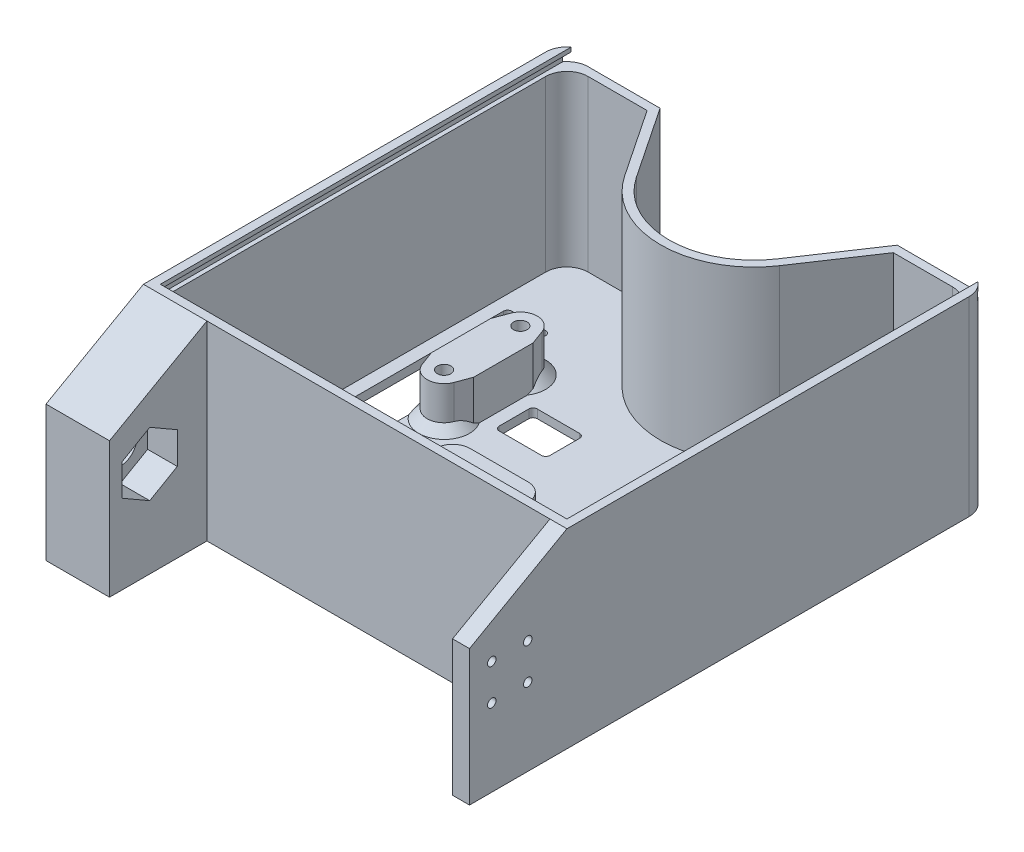
from build123d import *

# Parameters (mm, degrees)
AUFSATZ_LINEAR_AUSTRAGEN1_DEPTH  = 45
WANDUNG1_T                       = -2
SKIZZE1_W                        = 10
SKIZZE1_H                        = 42
SCHNITT_LINEAR_AUSTRAGEN1_DEPTH  = 2
SKIZZE2_R                        = 1.6
AUFSATZ_LINEAR_AUSTRAGEN2_DEPTH  = 10
VERRUNDUNG1_R                    = 1
SKIZZE6_R                        = 1.6
SCHNITT_LINEAR_AUSTRAGEN2_DEPTH  = 79.0320447
SCHNITT_LINEAR_AUSTRAGEN3_DEPTH  = 9
FASE1_SIZE                       = 2
SKIZZE8_W                        = 12
SKIZZE8_H                        = 9
SCHNITT_LINEAR_AUSTRAGEN4_DEPTH  = 2
VERRUNDUNG2_R                    = 1
VERRUNDUNG3_R                    = 5
VERRUNDUNG4_R                    = 5
SCHNITT_LINEAR_AUSTRAGEN5_REACH  = 85.815
AUFSATZ_LINEAR_AUSTRAGEN3_DEPTH  = 12
AUFSATZ_LINEAR_AUSTRAGEN4_DEPTH  = 2
FASE2_SIZE                       = 2
SKIZZE13_R                       = 1.6
SCHNITT_LINEAR_AUSTRAGEN6_DEPTH  = 2
SKIZZE14_W                       = 15
SKIZZE14_H                       = 45
SKIZZE14_W_2                     = 4
AUFSATZ_LINEAR_AUSTRAGEN5_DEPTH  = 23
SKIZZE18_R                       = 1
SCHNITT_LINEAR_AUSTRAGEN8_DEPTH  = 4
SKIZZE19_R                       = 2.5
SCHNITT_LINEAR_AUSTRAGEN9_DEPTH  = 2.5
SKIZZE20_W                       = 5
SKIZZE20_H                       = 10
SCHNITT_LINEAR_AUSTRAGEN10_DEPTH = 2
SKIZZE21_R                       = 4
SCHNITT_LINEAR_AUSTRAGEN11_DEPTH = 15
SKIZZE23_R                       = 7.5
SCHNITT_LINEAR_AUSTRAGEN12_DEPTH = 1
SKIZZE24_R                       = 7.5
SCHNITT_LINEAR_AUSTRAGEN13_DEPTH = 4
SCHNITT_LINEAR_AUSTRAGEN13_DRAFT = -45
SCHNITT_LINEAR_AUSTRAGEN14_DEPTH = 7
SCHNITT_LINEAR_AUSTRAGEN15_REACH = 133.735
SKIZZE31_W                       = 96
SKIZZE31_H                       = 3
SCHNITT_LINEAR_AUSTRAGEN16_DEPTH = 30
SKIZZE32_W                       = 98
SKIZZE32_H                       = 2
SCHNITT_LINEAR_AUSTRAGEN17_DEPTH = 99


# Some blends are built 0.0001 mm under size
with BuildPart() as part:
    # Grundplatte → Aufsatz-Linear austragen1 (new body)
    with BuildSketch(Plane(origin=(0, 0, 0), x_dir=(1, 0, 0), z_dir=(0, 1, 0))):
        with BuildLine():
            Line((-50, 50), (-50, -50))
            Line((-50, -50), (50, -50))
            Line((50, -50), (50, 50))
            Line((50, 50), (28, 50))
            Line((28, 50), (16.61985221, 33))
            ThreePointArc((16.61985221, 33), (0, 24.125669082), (-16.61985221, 33))
            Line((-16.61985221, 33), (-28, 50))
            Line((-28, 50), (-50, 50))
        make_face()
    extrude(amount=AUFSATZ_LINEAR_AUSTRAGEN1_DEPTH)

    # Wandung1
    wandung1_openings = [part.faces().sort_by_distance(p)[0] for p in [
        (0, 45, 4.219695438),
    ]]
    offset(amount=WANDUNG1_T, openings=wandung1_openings, kind=Kind.INTERSECTION)

    # Skizze1 → Schnitt-Linear austragen1 (cut)
    with BuildSketch(Plane(origin=(0, 2, 0), x_dir=(1, 0, 0), z_dir=(0, 1, 0))):
        with Locations((-40, 10)):
            Rectangle(SKIZZE1_W, SKIZZE1_H)
        with Locations((40, 10)):
            Rectangle(SKIZZE1_W, SKIZZE1_H)
    extrude(amount=-SCHNITT_LINEAR_AUSTRAGEN1_DEPTH, mode=Mode.SUBTRACT)

    # Skizze2 → Aufsatz-Linear austragen2 (add)
    # profile 1 of 2: a face of its own
    with BuildSketch(Plane(origin=(0, 2, 0), x_dir=(1, 0, 0), z_dir=(0, 1, 0))):
        with BuildLine():
            Line((-35, 16), (-35, 4))
            Line((-35, 4), (-35, 3))
            Line((-35, 3), (-33.753255524, -0.383138811))
            ThreePointArc((-33.753255524, -0.383138811), (-30, -3), (-26.246744476, -0.383138811))
            Line((-26.246744476, -0.383138811), (-25, 3))
            Line((-25, 3), (-25, 4))
            Line((-25, 4), (-25, 16))
            Line((-25, 16), (-25, 17))
            Line((-25, 17), (-26.246744476, 20.383138811))
            ThreePointArc((-26.246744476, 20.383138811), (-30, 23), (-33.753255524, 20.383138811))
            Line((-33.753255524, 20.383138811), (-35, 17))
            Line((-35, 17), (-35, 16))
        make_face()
        with Locations(Location((-30, 19, 0), (0, 0, 270))):
            Circle(SKIZZE2_R, mode=Mode.SUBTRACT)
        with Locations(Location((-30, 1, 0), (0, 0, 270))):
            Circle(SKIZZE2_R, mode=Mode.SUBTRACT)
    # profile 2 of 2: a face of its own
    with BuildSketch(Plane(origin=(0, 2, 0), x_dir=(1, 0, 0), z_dir=(0, 1, 0))):
        with BuildLine():
            Line((35, 16), (35, 17))
            Line((35, 17), (33.753255524, 20.383138811))
            ThreePointArc((33.753255524, 20.383138811), (30, 23), (26.246744476, 20.383138811))
            Line((26.246744476, 20.383138811), (25, 17))
            Line((25, 17), (25, 16))
            Line((25, 16), (25, 4))
            Line((25, 4), (25, 3))
            Line((25, 3), (26.246744476, -0.383138811))
            ThreePointArc((26.246744476, -0.383138811), (30, -3), (33.753255524, -0.383138811))
            Line((33.753255524, -0.383138811), (35, 3))
            Line((35, 3), (35, 4))
            Line((35, 4), (35, 16))
        make_face()
        with Locations(Location((30, 1, 0), (0, 0, 90))):
            Circle(SKIZZE2_R, mode=Mode.SUBTRACT)
        with Locations(Location((30, 19, 0), (0, 0, 90))):
            Circle(SKIZZE2_R, mode=Mode.SUBTRACT)
    extrude(amount=AUFSATZ_LINEAR_AUSTRAGEN2_DEPTH)

    # Verrundung1
    verrundung1_edges = [part.edges().sort_by_distance(p)[0] for p in [
        (-35, 1, -31),
        (-35, 1, 11),
        (-45, 1, 11),
        (-45, 1, -31),
        (45, 1, -31),
        (45, 1, 11),
        (35, 1, 11),
        (35, 1, -31),
    ]]
    fillet(verrundung1_edges, radius=VERRUNDUNG1_R)

    # Skizze6 → Schnitt-Linear austragen2 (cut, through all)
    with BuildSketch(Plane(origin=(0, 12, 0), x_dir=(1, 0, 0), z_dir=(0, 1, 0))):
        with Locations(Location((-30, 19, 0), (0, 0, 270))):
            Circle(SKIZZE6_R)
        with Locations(Location((-30, 1, 0), (0, 0, 270))):
            Circle(SKIZZE6_R)
        with Locations(Location((30, 19, 0), (0, 0, 90))):
            Circle(SKIZZE6_R)
        with Locations(Location((30, 1, 0), (0, 0, 90))):
            Circle(SKIZZE6_R)
    extrude(amount=-SCHNITT_LINEAR_AUSTRAGEN2_DEPTH, mode=Mode.SUBTRACT)

    # Skizze7 → Schnitt-Linear austragen3 (cut)
    with BuildSketch(Plane.XZ):
        Polygon((-26.709103466, -1), (-28.354551733, 1.85), (-31.645448267, 1.85), (-33.290896534, -1), (-31.645448267, -3.85), (-28.354551733, -3.85), align=None)
        Polygon((28.354551733, -21.85), (26.709103466, -19), (28.354551733, -16.15), (31.645448267, -16.15), (33.290896534, -19), (31.645448267, -21.85), align=None)
        Polygon((-26.709103466, -19), (-28.354551733, -16.15), (-31.645448267, -16.15), (-33.290896534, -19), (-31.645448267, -21.85), (-28.354551733, -21.85), align=None)
        Polygon((28.354551733, -3.85), (26.709103466, -1), (28.354551733, 1.85), (31.645448267, 1.85), (33.290896534, -1), (31.645448267, -3.85), align=None)
    extrude(amount=-SCHNITT_LINEAR_AUSTRAGEN3_DEPTH, mode=Mode.SUBTRACT)

    # Fase1
    # the kernel refuses this chamfer: 2 mm, written as the material it adds along each edge
    with BuildSketch(Plane(origin=(33.753255524, 2, 0.383138811), x_dir=(0.9379591204561566, -0.02749587661058633, 0.3456539673177909), z_dir=(0.3457847026662013, 0, -0.9383138810664834))) as fase1_piece_1_section:
        Polygon((FASE1_SIZE * 0.999621916911, -FASE1_SIZE * 0.0274958766106), (-FASE1_SIZE * 0.0274958766106, -FASE1_SIZE * 0.999621916911), (0, 0), align=None)
    fase1_piece_1 = extrude(amount=8.748917251, mode=Mode.PRIVATE)
    fase1_piece_1 = split(fase1_piece_1, bisect_by=Plane(origin=(35, 2.810043693, -0.69339811), z_dir=(-1, 0, 0)), keep=Keep.TOP, mode=Mode.PRIVATE)
    add(fase1_piece_1)
    with BuildSketch(Plane(origin=(30, 2, -1), x_dir=(-0.5946157089023157, 0, -0.8040100488965276), z_dir=(0.8040100488965276, 0, -0.5946157089023157))) as fase1_piece_2_section:
        Polygon((4 + FASE1_SIZE, 0), (4, FASE1_SIZE), (4, 0), align=None)
    fase1_piece_2 = revolve(axis=Axis((30, 2, -1), (0, 1, 0)), revolution_arc=213.285054007, mode=Mode.PRIVATE)
    fase1_piece_2 = split(fase1_piece_2, bisect_by=Plane(origin=(35, 2.618842305, 0.921149391), z_dir=(-1, 0, 0)), keep=Keep.TOP, mode=Mode.PRIVATE)
    add(fase1_piece_2)
    with BuildSketch(Plane(origin=(36.778497275, 2, -12.173908309), x_dir=(0.937959120456157, -0.027495876610586348, -0.34565396731779), z_dir=(-0.34578470266620037, 0, -0.9383138810664838))) as fase1_piece_3_section:
        Polygon((FASE1_SIZE * 0.999621916911, -FASE1_SIZE * 0.0274958766106), (-FASE1_SIZE * 0.0274958766106, -FASE1_SIZE * 0.999621916911), (0, 0), align=None)
    fase1_piece_3 = extrude(amount=8.748917251, mode=Mode.PRIVATE)
    fase1_piece_3 = split(fase1_piece_3, bisect_by=Plane(origin=(35, 2.810043693, -19.30660189), z_dir=(-1, 0, 0)), keep=Keep.TOP, mode=Mode.PRIVATE)
    add(fase1_piece_3)
    with BuildSketch(Plane(origin=(30, 2, -19), x_dir=(0.9383138810664835, 0, -0.3457847026662016), z_dir=(0.3457847026662016, 0, 0.9383138810664835))) as fase1_piece_4_section:
        Polygon((4 + FASE1_SIZE, 0), (4, FASE1_SIZE), (4, 0), align=None)
    fase1_piece_4 = revolve(axis=Axis((30, 2, -19), (0, 1, 0)), revolution_arc=213.285054007, mode=Mode.PRIVATE)
    fase1_piece_4 = split(fase1_piece_4, bisect_by=Plane(origin=(35, 2.568302244, -21.912371656), z_dir=(-1, 0, 0)), keep=Keep.TOP, mode=Mode.PRIVATE)
    add(fase1_piece_4)
    with BuildSketch(Plane(origin=(-33.753255524, 2, -20.383138811), x_dir=(-0.9379591204561563, -0.02749587661058632, -0.34565396731779174), z_dir=(-0.34578470266620215, 0, 0.9383138810664832))) as fase1_piece_5_section:
        Polygon((FASE1_SIZE * 0.999621916911, -FASE1_SIZE * 0.0274958766106), (-FASE1_SIZE * 0.0274958766106, -FASE1_SIZE * 0.999621916911), (0, 0), align=None)
    fase1_piece_5 = extrude(amount=8.748917251, mode=Mode.PRIVATE)
    fase1_piece_5 = split(fase1_piece_5, bisect_by=Plane(origin=(-35, 2.810043693, -19.30660189), z_dir=(1, 0, 0)), keep=Keep.TOP, mode=Mode.PRIVATE)
    add(fase1_piece_5)
    with BuildSketch(Plane(origin=(-30, 2, -19), x_dir=(0.5946157089023089, 0, 0.8040100488965327), z_dir=(-0.8040100488965327, 0, 0.5946157089023089))) as fase1_piece_6_section:
        Polygon((4 + FASE1_SIZE, 0), (4, FASE1_SIZE), (4, 0), align=None)
    fase1_piece_6 = revolve(axis=Axis((-30, 2, -19), (0, 1, 0)), revolution_arc=213.285054007, mode=Mode.PRIVATE)
    fase1_piece_6 = split(fase1_piece_6, bisect_by=Plane(origin=(-35, 2.618842305, -20.921149391), z_dir=(1, 0, 0)), keep=Keep.TOP, mode=Mode.PRIVATE)
    add(fase1_piece_6)
    with BuildSketch(Plane(origin=(-36.778497275, 2, -7.826091691), x_dir=(-0.937959120456156, -0.02749587661058632, 0.3456539673177927), z_dir=(0.3457847026662031, 0, 0.9383138810664828))) as fase1_piece_7_section:
        Polygon((FASE1_SIZE * 0.999621916911, -FASE1_SIZE * 0.0274958766106), (-FASE1_SIZE * 0.0274958766106, -FASE1_SIZE * 0.999621916911), (0, 0), align=None)
    fase1_piece_7 = extrude(amount=8.748917251, mode=Mode.PRIVATE)
    fase1_piece_7 = split(fase1_piece_7, bisect_by=Plane(origin=(-35, 2.810043693, -0.69339811), z_dir=(1, 0, 0)), keep=Keep.TOP, mode=Mode.PRIVATE)
    add(fase1_piece_7)
    with BuildSketch(Plane(origin=(-30, 2, -1), x_dir=(-0.9383138810664808, 0, 0.34578470266620803), z_dir=(-0.34578470266620803, 0, -0.9383138810664808))) as fase1_piece_8_section:
        Polygon((4 + FASE1_SIZE, 0), (4, FASE1_SIZE), (4, 0), align=None)
    fase1_piece_8 = revolve(axis=Axis((-30, 2, -1), (0, 1, 0)), revolution_arc=213.285054007, mode=Mode.PRIVATE)
    fase1_piece_8 = split(fase1_piece_8, bisect_by=Plane(origin=(-35, 2.568302244, 1.912371656), z_dir=(1, 0, 0)), keep=Keep.TOP, mode=Mode.PRIVATE)
    add(fase1_piece_8)

    # Skizze8 → Schnitt-Linear austragen4 (cut)
    with BuildSketch(Plane.XZ):
        with Locations((16, -9.5)):
            Rectangle(SKIZZE8_W, SKIZZE8_H)
        with Locations((-16, -9.5)):
            Rectangle(SKIZZE8_W, SKIZZE8_H)
    extrude(amount=-SCHNITT_LINEAR_AUSTRAGEN4_DEPTH, mode=Mode.SUBTRACT)

    # Verrundung2
    verrundung2_edges = [part.edges().sort_by_distance(p)[0] for p in [
        (-10, 1, -14),
        (-10, 1, -5),
        (-22, 1, -5),
        (-22, 1, -14),
        (10, 1, -5),
        (10, 1, -14),
        (22, 1, -14),
        (22, 1, -5),
    ]]
    fillet(verrundung2_edges, radius=VERRUNDUNG2_R)

    # Verrundung3
    verrundung3_edges = [part.edges().sort_by_distance(p)[0] for p in [
        (-50, 22.5, -50),
        (50, 22.5, -50),
    ]]
    fillet(verrundung3_edges, radius=VERRUNDUNG3_R)

    # Verrundung4
    verrundung4_edges = [part.edges().sort_by_distance(p)[0] for p in [
        (48, 23.5, -48),
        (-48, 23.5, -48),
    ]]
    fillet(verrundung4_edges, radius=VERRUNDUNG4_R)

    # Skizze9 → Schnitt-Linear austragen5 (cut, up to next)
    with BuildSketch(Plane.XZ, mode=Mode.PRIVATE) as schnitt_linear_austragen5_sk1:
        with BuildLine():
            Line((-6.8, 43), (6.8, 43))
            ThreePointArc((6.8, 43), (7.648528137, 42.648528137), (8, 41.8))
            Line((8, 41.8), (8, 20.2))
            ThreePointArc((8, 20.2), (7.648528137, 19.351471863), (6.8, 19))
            Line((6.8, 19), (-6.8, 19))
            ThreePointArc((-6.8, 19), (-7.648528137, 19.351471863), (-8, 20.2))
            Line((-8, 20.2), (-8, 41.8))
            ThreePointArc((-8, 41.8), (-7.648528137, 42.648528137), (-6.8, 43))
        make_face()
    schnitt_linear_austragen5_tool1 = extrude(schnitt_linear_austragen5_sk1.sketch, amount=-SCHNITT_LINEAR_AUSTRAGEN5_REACH, mode=Mode.PRIVATE) & part.part
    add(schnitt_linear_austragen5_tool1.solids().sort_by_distance((0, 0, 31))[0], mode=Mode.SUBTRACT)

    # Skizze11 → Aufsatz-Linear austragen3 (add)
    with BuildSketch(Plane(origin=(0, 2, 0), x_dir=(1, 0, 0), z_dir=(0, 1, 0))):
        with BuildLine():
            Line((-6.8, -46), (6.8, -46))
            ThreePointArc((6.8, -46), (9.769848481, -44.769848481), (11, -41.8))
            Line((11, -41.8), (11, -20.2))
            ThreePointArc((11, -20.2), (9.769848481, -17.230151519), (6.8, -16))
            Line((6.8, -16), (-6.8, -16))
            ThreePointArc((-6.8, -16), (-9.769848481, -17.230151519), (-11, -20.2))
            Line((-11, -20.2), (-11, -41.8))
            ThreePointArc((-11, -41.8), (-9.769848481, -44.769848481), (-6.8, -46))
        make_face()
        with BuildLine():
            Line((-8, -20.2), (-8, -41.8))
            ThreePointArc((-8, -41.8), (-7.648528137, -42.648528137), (-6.8, -43))
            Line((-6.8, -43), (6.8, -43))
            ThreePointArc((6.8, -43), (7.648528137, -42.648528137), (8, -41.8))
            Line((8, -41.8), (8, -20.2))
            ThreePointArc((8, -20.2), (7.648528137, -19.351471863), (6.8, -19))
            Line((6.8, -19), (-6.8, -19))
            ThreePointArc((-6.8, -19), (-7.648528137, -19.351471863), (-8, -20.2))
        make_face(mode=Mode.SUBTRACT)
    extrude(amount=AUFSATZ_LINEAR_AUSTRAGEN3_DEPTH)

    # Skizze12 → Aufsatz-Linear austragen4 (add)
    with BuildSketch(Plane(origin=(0, 14, 0), x_dir=(1, 0, 0), z_dir=(0, 1, 0))):
        with BuildLine():
            Line((11, -41.8), (11, -20.2))
            ThreePointArc((11, -20.2), (9.769848481, -17.230151519), (6.8, -16))
            Line((6.8, -16), (-6.8, -16))
            ThreePointArc((-6.8, -16), (-9.769848481, -17.230151519), (-11, -20.2))
            Line((-11, -20.2), (-11, -41.8))
            ThreePointArc((-11, -41.8), (-9.769848481, -44.769848481), (-6.8, -46))
            Line((-6.8, -46), (6.8, -46))
            ThreePointArc((6.8, -46), (9.769848481, -44.769848481), (11, -41.8))
        make_face()
    extrude(amount=AUFSATZ_LINEAR_AUSTRAGEN4_DEPTH)

    # Fase2
    fase2_edges = [part.edges().sort_by_distance(p)[0] for p in [
        (9.769848481, 2, 44.769848481),
        (11, 2, 31),
        (9.769848481, 2, 17.230151519),
        (0, 2, 16),
        (-9.769848481, 2, 17.230151519),
        (-11, 2, 31),
        (-9.769848481, 2, 44.769848481),
        (0, 2, 46),
    ]]
    chamfer(fase2_edges, length=FASE2_SIZE - 0.0001)  # a hair under: the kernel refuses the full size

    # Skizze13 → Schnitt-Linear austragen6 (cut)
    with BuildSketch(Plane(origin=(0, 16, 0), x_dir=(1, 0, 0), z_dir=(0, 1, 0))):
        with Locations(Location((0, -23, 0), (0, 0, 270))):
            Circle(SKIZZE13_R)
        with Locations(Location((0, -39, 0), (0, 0, 270))):
            Circle(SKIZZE13_R)
    extrude(amount=-SCHNITT_LINEAR_AUSTRAGEN6_DEPTH, mode=Mode.SUBTRACT)

    # Skizze14 → Aufsatz-Linear austragen5 (add)
    with BuildSketch(Plane.XY.offset(50)):
        with Locations((-42.5, 22.5)):
            Rectangle(SKIZZE14_W, SKIZZE14_H)
        with Locations((48, 22.5)):
            Rectangle(SKIZZE14_W_2, SKIZZE14_H)
    extrude(amount=AUFSATZ_LINEAR_AUSTRAGEN5_DEPTH)

    # Skizze18 → Schnitt-Linear austragen8 (cut)
    with BuildSketch(Plane(origin=(50, 0, 0), x_dir=(0, 0, -1), z_dir=(1, 0, 0))):
        with Locations((-59.257359313, 18.257359313)):
            Circle(SKIZZE18_R)
        with Locations((-67.742640687, 18.257359313)):
            Circle(SKIZZE18_R)
        with Locations((-67.742640687, 26.742640687)):
            Circle(SKIZZE18_R)
        with Locations((-59.257359313, 26.742640687)):
            Circle(SKIZZE18_R)
    extrude(amount=-SCHNITT_LINEAR_AUSTRAGEN8_DEPTH, mode=Mode.SUBTRACT)

    # Skizze19 → Schnitt-Linear austragen9 (cut)
    with BuildSketch(Plane.ZY.offset(-46)):
        with Locations(Location((63.5, 22.5, 0), (0, 0, 270))):
            Circle(SKIZZE19_R)
    extrude(amount=-SCHNITT_LINEAR_AUSTRAGEN9_DEPTH, mode=Mode.SUBTRACT)

    # Skizze20 → Schnitt-Linear austragen10 (cut)
    with BuildSketch(Plane.XY.offset(50)):
        with Locations((43.5, 22.5)):
            Rectangle(SKIZZE20_W, SKIZZE20_H)
    extrude(amount=-SCHNITT_LINEAR_AUSTRAGEN10_DEPTH, mode=Mode.SUBTRACT)

    # Skizze21 → Schnitt-Linear austragen11 (cut)
    with BuildSketch(Plane.ZY.offset(50)):
        with Locations((63.5, 22.5)):
            Circle(SKIZZE21_R)
    extrude(amount=-SCHNITT_LINEAR_AUSTRAGEN11_DEPTH, mode=Mode.SUBTRACT)

    # Skizze23 → Schnitt-Linear austragen12 (cut)
    with BuildSketch(Plane.ZY.offset(50)):
        with Locations((63.5, 22.5)):
            Circle(SKIZZE23_R)
    extrude(amount=-SCHNITT_LINEAR_AUSTRAGEN12_DEPTH, mode=Mode.SUBTRACT)


with BuildPart() as schnitt_linear_austragen13_tool:
    # Skizze24 → Schnitt-Linear austragen13 (with draft: the straight prism first)
    with BuildSketch(Plane.ZY.offset(49)):
        with Locations((63.5, 22.5)):
            Circle(SKIZZE24_R)
    extrude(amount=-SCHNITT_LINEAR_AUSTRAGEN13_DEPTH)
    # Schnitt-Linear austragen13: the draft: its side faces are tilted about the plane it starts from
    schnitt_linear_austragen13_sides = [schnitt_linear_austragen13_tool.faces().sort_by_distance(p)[0] for p in [
        (-47, 22.5, 56),
    ]]
    draft(schnitt_linear_austragen13_sides, Plane.ZY.offset(49), SCHNITT_LINEAR_AUSTRAGEN13_DRAFT)


with BuildPart() as part_1:
    add(part.part)

    # Schnitt-Linear austragen13: cut by schnitt_linear_austragen13_tool
    add(schnitt_linear_austragen13_tool.part, mode=Mode.SUBTRACT)

    # Skizze26 → Schnitt-Linear austragen14 (cut)
    with BuildSketch(Plane(origin=(-35, 0, 0), x_dir=(0, 0, -1), z_dir=(1, 0, 0))):
        Polygon((-57, 18.74722325), (-57, 26.25277675), (-63.5, 30.005553499), (-70, 26.25277675), (-70, 18.74722325), (-63.5, 14.994446501), align=None)
    extrude(amount=-SCHNITT_LINEAR_AUSTRAGEN14_DEPTH, mode=Mode.SUBTRACT)

    # Schnitt-Linear austragen15: up to this face of the body (flat: up to its plane)
    schnitt_linear_austragen15_end = Plane(part_1.part.faces().sort_by_distance((50, 22.5, 13.882577982))[0])
    # Skizze29 → Schnitt-Linear austragen15 (cut, up to the picked face)
    with BuildSketch(Plane.ZY.offset(50), mode=Mode.PRIVATE) as schnitt_linear_austragen15_sk1:
        Polygon((73, 45), (73, 32), (50, 45), align=None)
    schnitt_linear_austragen15_tool1 = split(extrude(schnitt_linear_austragen15_sk1.sketch, amount=-SCHNITT_LINEAR_AUSTRAGEN15_REACH, mode=Mode.PRIVATE), bisect_by=schnitt_linear_austragen15_end, keep=Keep.BOTH, mode=Mode.PRIVATE)
    add(schnitt_linear_austragen15_tool1.solids().sort_by(Axis((-50, 40.666667, 65.333333), (1, 0, 0)))[0], mode=Mode.SUBTRACT)

    # Skizze31 → Schnitt-Linear austragen16 (cut)
    with BuildSketch(Plane(origin=(0, 0, -50), x_dir=(-1, 0, 0), z_dir=(0, 0, -1))):
        with Locations((0, 43.5)):
            Rectangle(SKIZZE31_W, SKIZZE31_H)
    extrude(amount=-SCHNITT_LINEAR_AUSTRAGEN16_DEPTH, mode=Mode.SUBTRACT)

    # Skizze32 → Schnitt-Linear austragen17 (cut)
    with BuildSketch(Plane(origin=(0, 0, -50), x_dir=(-1, 0, 0), z_dir=(0, 0, -1))):
        with Locations((0, 43)):
            Rectangle(SKIZZE32_W, SKIZZE32_H)
    extrude(amount=-SCHNITT_LINEAR_AUSTRAGEN17_DEPTH, mode=Mode.SUBTRACT)


solid = part_1.part
